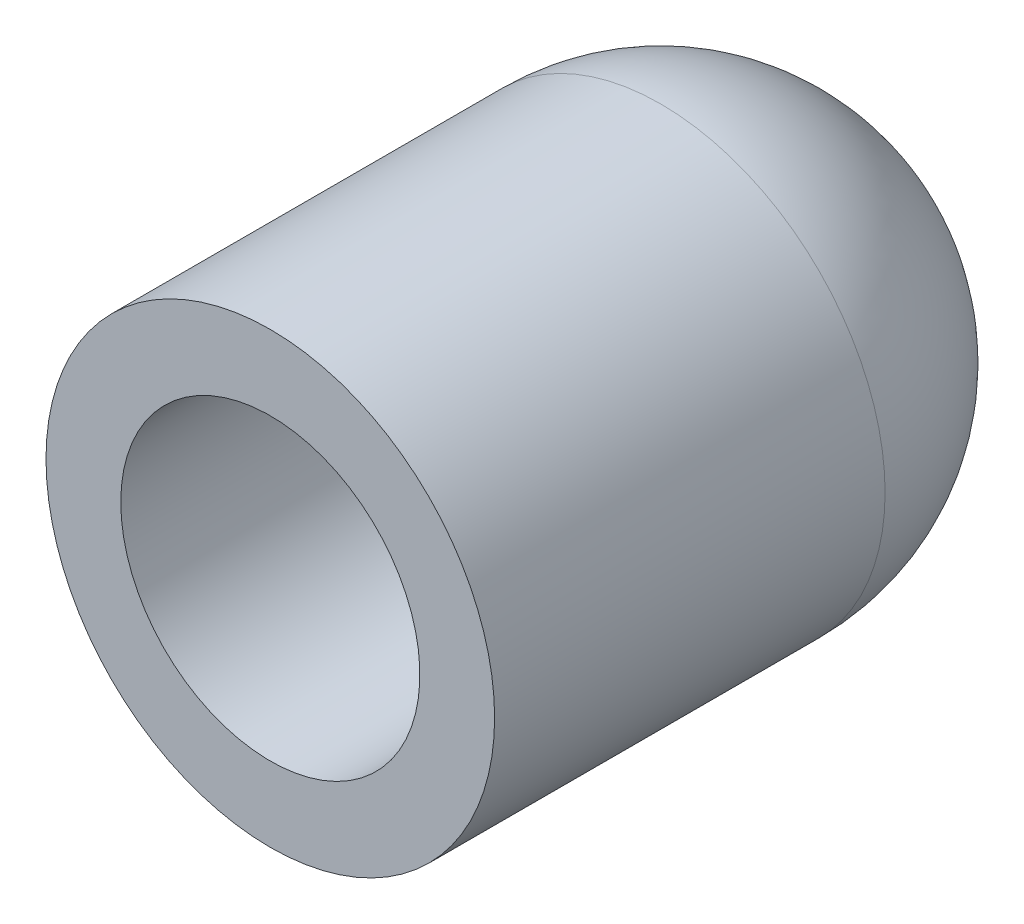
from build123d import *


with BuildPart() as part:
    # Sketch1 → Revolve1 (revolve)
    with BuildSketch(Plane(origin=(0, 0, 0), x_dir=(1, 0, 0), z_dir=(0, 1, 0))):
        with BuildLine():
            ThreePointArc((3.375, 0), (2.386485387, 2.386485387), (0, 3.375))
            Line((0, 3.375), (0, 2.25))
            ThreePointArc((0, 2.25), (1.590990258, 1.590990258), (2.25, 0))
            Line((2.25, 0), (2.25, -5.875))
            Line((2.25, -5.875), (3.375, -5.875))
            Line((3.375, -5.875), (3.375, 0))
        make_face()
    revolve(axis=Axis((0, 0, -3.375), (0, 0, 1)))


solid = part.part
